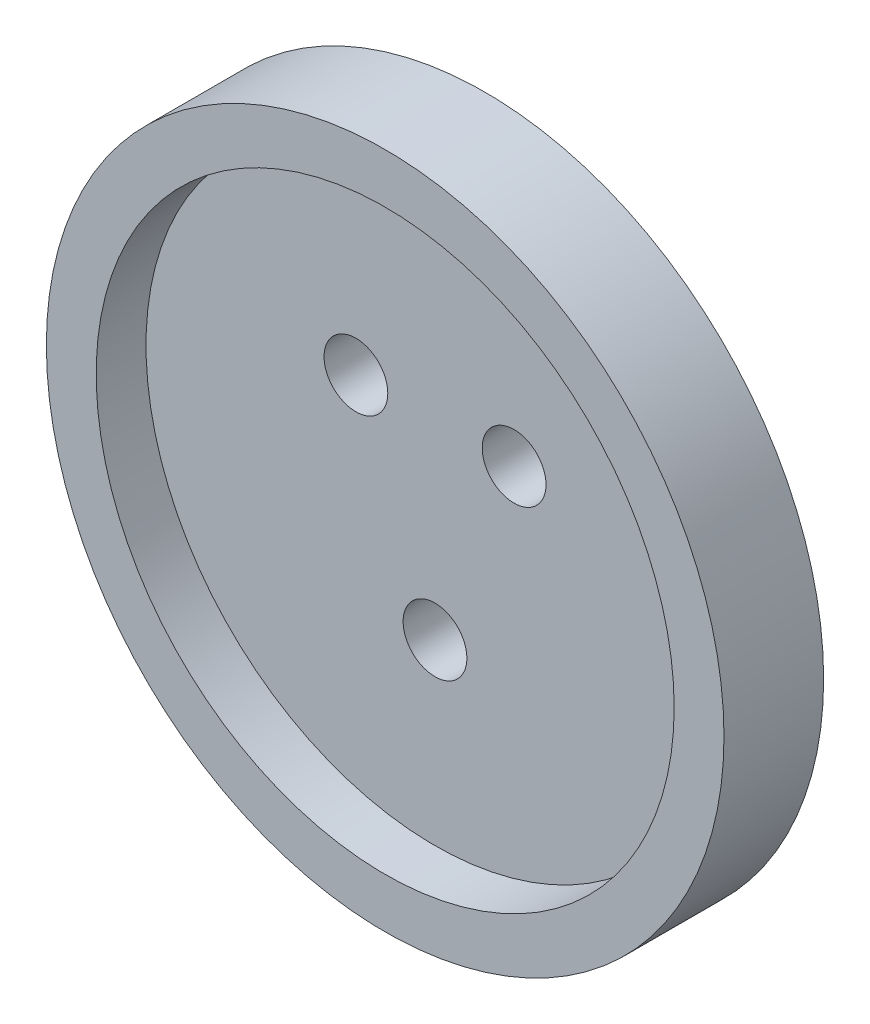
from build123d import *

# Parameters (mm, degrees)
SKETCH1_R      = 24
EXTRUDE1_DEPTH = 4
SKETCH2_R      = 24
EXTRUDE2_DEPTH = 1
SKETCH3_R      = 3.2
EXTRUDE3_DEPTH = 35.307433597
SKETCH4_R      = 34
SKETCH4_R_2    = 24
EXTRUDE4_DEPTH = 5
SKETCH5_R      = 34
SKETCH5_R_2    = 29
EXTRUDE5_DEPTH = 5


with BuildPart() as part:
    # Sketch1 → Extrude1 (new body)
    with BuildSketch(Plane.XY):
        Circle(SKETCH1_R)
    extrude(amount=EXTRUDE1_DEPTH)

    # Sketch2 → Extrude2 (add)
    with BuildSketch(Plane.XY.offset(4)):
        Circle(SKETCH2_R)
    extrude(amount=EXTRUDE2_DEPTH)

    # Sketch3 → Extrude3 (cut, through all)
    with BuildSketch(Plane.XY.offset(5)):
        with Locations((-7.9375, 7.9375)):
            Circle(SKETCH3_R)
        with Locations((7.9375, 7.9375)):
            Circle(SKETCH3_R)
        with Locations((0, -11.1125)):
            Circle(SKETCH3_R)
    extrude(amount=-EXTRUDE3_DEPTH, mode=Mode.SUBTRACT)

    # Sketch4 → Extrude4 (add)
    with BuildSketch(Plane(origin=(0, 0, 0), x_dir=(-1, 0, 0), z_dir=(0, 0, -1))):
        Circle(SKETCH4_R)
        Circle(SKETCH4_R_2, mode=Mode.SUBTRACT)
    extrude(amount=-EXTRUDE4_DEPTH)

    # Sketch5 → Extrude5 (add)
    with BuildSketch(Plane.XY.offset(5)):
        Circle(SKETCH5_R)
        Circle(SKETCH5_R_2, mode=Mode.SUBTRACT)
    extrude(amount=EXTRUDE5_DEPTH)


solid = part.part
